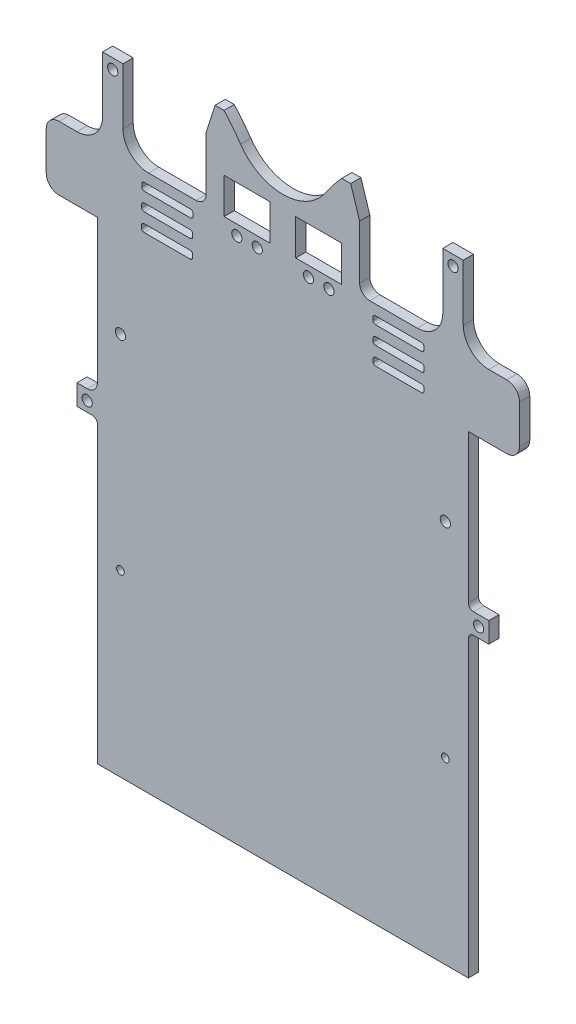
from build123d import *

# Parameters (mm, degrees)
SKETCH_1_R          = 2
SKETCH_1_R_2        = 1.5
EXTRUDE_1_DEPTH     = 4
SKETCH_2_R          = 2
CUT_EXTRUDE_1_DEPTH = 26
EXTRUDE_3_DEPTH     = 4
FILLET_1_R          = 4
FILLET_2_R          = 4
SKETCH_5_W          = 10
SKETCH_5_H          = 14
EXTRUDE_4_DEPTH     = 4
FILLET_3_R          = 4
FILLET_1_2_DEPTH    = 4
CUT_EXTRUDE_2_DEPTH = 10
FILLET_5_R          = 5


with BuildPart() as part:
    # 草图1 → 凸台-拉伸1 (new body)
    with BuildSketch(Plane.XY):
        with BuildLine():
            Line((0, -30), (0, 87))
            Line((0, 87), (-8, 87))
            Line((-8, 87), (-8, 95))
            Line((-8, 95), (0, 95))
            Line((0, 95), (0, 155))
            Line((0, 155), (-20, 155))
            Line((-20, 155), (-20, 180))
            Line((-20, 180), (-8, 180))
            ThreePointArc((-8, 180), (-0.928932188, 182.928932188), (2, 190))
            Line((2, 190), (2, 212))
            Line((2, 212), (10, 212))
            Line((10, 212), (10, 190))
            ThreePointArc((10, 190), (12.928932188, 182.928932188), (20, 180))
            Line((20, 180), (72.5, 180))
            Line((72.5, 180), (125, 180))
            ThreePointArc((125, 180), (132.071067812, 182.928932188), (135, 190))
            Line((135, 190), (135, 212))
            Line((135, 212), (143, 212))
            Line((143, 212), (143, 190))
            ThreePointArc((143, 190), (145.928932188, 182.928932188), (153, 180))
            Line((153, 180), (165, 180))
            Line((165, 180), (165, 155))
            Line((165, 155), (145, 155))
            Line((145, 155), (145, 95))
            Line((145, 95), (153, 95))
            Line((153, 95), (153, 87))
            Line((153, 87), (145, 87))
            Line((145, 87), (145, -30))
            Line((145, -30), (0, -30))
        make_face()
        with Locations(Location((9, 120, 0), (0, 0, 180))):
            Circle(SKETCH_1_R, mode=Mode.SUBTRACT)
        with Locations(Location((9, 40, 0), (0, 0, 180))):
            Circle(SKETCH_1_R_2, mode=Mode.SUBTRACT)
        with Locations((139, 208)):
            Circle(SKETCH_1_R, mode=Mode.SUBTRACT)
        with Locations(Location((149, 91, 0), (0, 0, 180))):
            Circle(SKETCH_1_R, mode=Mode.SUBTRACT)
        with Locations((136, 40)):
            Circle(SKETCH_1_R_2, mode=Mode.SUBTRACT)
        with Locations((136, 120)):
            Circle(SKETCH_1_R, mode=Mode.SUBTRACT)
        with Locations((-4, 91)):
            Circle(SKETCH_1_R, mode=Mode.SUBTRACT)
        with Locations(Location((6, 208, 0), (0, 0, 180))):
            Circle(SKETCH_1_R, mode=Mode.SUBTRACT)
    extrude(amount=EXTRUDE_1_DEPTH)

    # 草图2 → 切除-拉伸1 (cut)
    with BuildSketch(Plane(origin=(0, 0, 0), x_dir=(-1, 0, 0), z_dir=(0, 0, -1))):
        with Locations((-90.5, 176)):
            Circle(SKETCH_2_R)
        with Locations((-82.5, 176)):
            Circle(SKETCH_2_R)
        with Locations((-62.5, 176)):
            Circle(SKETCH_2_R)
        with Locations((-54.5, 176)):
            Circle(SKETCH_2_R)
    extrude(amount=-CUT_EXTRUDE_1_DEPTH, mode=Mode.SUBTRACT)

    # 草图4 → 凸台-拉伸3 (add)
    with BuildSketch(Plane(origin=(0, 0, 0), x_dir=(-1, 0, 0), z_dir=(0, 0, -1))):
        with BuildLine():
            Line((-102.5, 194), (-102.5, 204.972470671))
            Line((-102.5, 204.972470671), (-99, 215.944941341))
            Line((-99, 215.944941341), (-95.5, 215.944941341))
            ThreePointArc((-95.5, 215.944941341), (-92.121980777, 211.957020041), (-89.03099134, 207.742721229))
            ThreePointArc((-89.03099134, 207.742721229), (-72.5, 199), (-55.96900866, 207.742721229))
            ThreePointArc((-55.96900866, 207.742721229), (-52.878019223, 211.957020041), (-49.5, 215.944941341))
            Line((-49.5, 215.944941341), (-46, 215.944941341))
            Line((-46, 215.944941341), (-42.5, 204.972470671))
            Line((-42.5, 204.972470671), (-42.5, 194))
            Line((-42.5, 194), (-42.5, 180))
            Line((-42.5, 180), (-49.5, 180))
            Line((-49.5, 180), (-49.5, 194))
            Line((-49.5, 194), (-95.5, 194))
            Line((-95.5, 194), (-95.5, 180))
            Line((-95.5, 180), (-102.5, 180))
            Line((-102.5, 180), (-102.5, 194))
        make_face()
    extrude(amount=-EXTRUDE_3_DEPTH)

    # Fillet 1
    fillet_1_edges = [part.edges().sort_by_distance(p)[0] for p in [
        (102.5, 180, 2),
    ]]
    fillet(fillet_1_edges, radius=FILLET_1_R)

    # 圆角2
    fillet_2_edges = [part.edges().sort_by_distance(p)[0] for p in [
        (42.5, 180, 2),
    ]]
    fillet(fillet_2_edges, radius=FILLET_2_R)

    # 草图5 → 凸台-拉伸4 (add)
    with BuildSketch(Plane(origin=(0, 0, 0), x_dir=(-1, 0, 0), z_dir=(0, 0, -1))):
        with Locations((-72.5, 187)):
            Rectangle(SKETCH_5_W, SKETCH_5_H)
    extrude(amount=-EXTRUDE_4_DEPTH)

    # 圆角3
    fillet_3_edges = [part.edges().sort_by_distance(p)[0] for p in [
        (0, 95, 2),
    ]]
    fillet(fillet_3_edges, radius=FILLET_3_R)

    # Fillet 1 2: read off the stored shape, not the designer's step
    # Fillet 1 2 outline → Fillet 1 2 (add)
    with BuildSketch(Plane.XY):
        with BuildLine():
            add(Edge.make_bspline(
                [(0, 85), (0, 87), (-2, 87)],
                knots=[0, 0, 0, 1, 1, 1], degree=2, weights=[1, 0.707106781, 1]))
            Line((0, 85), (0, 87))
            Line((0, 87), (-2, 87))
        make_face()
        with BuildLine():
            add(Edge.make_bspline(
                [(145, 97), (145, 95), (147, 95)],
                knots=[0, 0, 0, 1, 1, 1], degree=2, weights=[1, 0.707106781, 1]))
            Line((145, 97), (145, 95))
            Line((145, 95), (147, 95))
        make_face()
        with BuildLine():
            add(Edge.make_bspline(
                [(147, 87), (145, 87), (145, 85)],
                knots=[0, 0, 0, 1, 1, 1], degree=2, weights=[1, 0.707106781, 1]))
            Line((147, 87), (145, 87))
            Line((145, 87), (145, 85))
        make_face()
    extrude(amount=FILLET_1_2_DEPTH)

    # 草图6 → 切除-拉伸2 (cut)
    with BuildSketch(Plane(origin=(0, 0, 0), x_dir=(-1, 0, 0), z_dir=(0, 0, -1))):
        with BuildLine():
            Line((-127.653125807, 175), (-127.653125807, 174))
            ThreePointArc((-127.653125807, 174), (-127.360232588, 173.292893219), (-126.653125807, 173))
            Line((-126.653125807, 173), (-108.653125807, 173))
            ThreePointArc((-108.653125807, 173), (-107.946019026, 173.292893219), (-107.653125807, 174))
            Line((-107.653125807, 174), (-107.653125807, 175))
            ThreePointArc((-107.653125807, 175), (-107.946019026, 175.707106781), (-108.653125807, 176))
            Line((-108.653125807, 176), (-126.653125807, 176))
            ThreePointArc((-126.653125807, 176), (-127.360232588, 175.707106781), (-127.653125807, 175))
        make_face()
        with BuildLine():
            Line((-36.251675409, 169), (-18.251675409, 169))
            ThreePointArc((-18.251675409, 169), (-17.544568628, 168.707106781), (-17.251675409, 168))
            Line((-17.251675409, 168), (-17.251675409, 167))
            ThreePointArc((-17.251675409, 167), (-17.544568628, 166.292893219), (-18.251675409, 166))
            Line((-18.251675409, 166), (-36.251675409, 166))
            ThreePointArc((-36.251675409, 166), (-36.958782191, 166.292893219), (-37.251675409, 167))
            Line((-37.251675409, 167), (-37.251675409, 168))
            ThreePointArc((-37.251675409, 168), (-36.958782191, 168.707106781), (-36.251675409, 169))
        make_face()
        with BuildLine():
            Line((-127.748324591, 168), (-127.748324591, 167))
            ThreePointArc((-127.748324591, 167), (-127.455431372, 166.292893219), (-126.748324591, 166))
            Line((-126.748324591, 166), (-108.748324591, 166))
            ThreePointArc((-108.748324591, 166), (-108.041217809, 166.292893219), (-107.748324591, 167))
            Line((-107.748324591, 167), (-107.748324591, 168))
            ThreePointArc((-107.748324591, 168), (-108.041217809, 168.707106781), (-108.748324591, 169))
            Line((-108.748324591, 169), (-126.748324591, 169))
            ThreePointArc((-126.748324591, 169), (-127.455431372, 168.707106781), (-127.748324591, 168))
        make_face()
        with BuildLine():
            Line((-36.346874193, 176), (-18.346874193, 176))
            ThreePointArc((-18.346874193, 176), (-17.639767412, 175.707106781), (-17.346874193, 175))
            Line((-17.346874193, 175), (-17.346874193, 174))
            ThreePointArc((-17.346874193, 174), (-17.639767412, 173.292893219), (-18.346874193, 173))
            Line((-18.346874193, 173), (-36.346874193, 173))
            ThreePointArc((-36.346874193, 173), (-37.053980974, 173.292893219), (-37.346874193, 174))
            Line((-37.346874193, 174), (-37.346874193, 175))
            ThreePointArc((-37.346874193, 175), (-37.053980974, 175.707106781), (-36.346874193, 176))
        make_face()
        with BuildLine():
            Line((-127.748324591, 161), (-127.748324591, 160))
            ThreePointArc((-127.748324591, 160), (-127.455431372, 159.292893219), (-126.748324591, 159))
            Line((-126.748324591, 159), (-108.748324591, 159))
            ThreePointArc((-108.748324591, 159), (-108.041217809, 159.292893219), (-107.748324591, 160))
            Line((-107.748324591, 160), (-107.748324591, 161))
            ThreePointArc((-107.748324591, 161), (-108.041217809, 161.707106781), (-108.748324591, 162))
            Line((-108.748324591, 162), (-126.748324591, 162))
            ThreePointArc((-126.748324591, 162), (-127.455431372, 161.707106781), (-127.748324591, 161))
        make_face()
        with BuildLine():
            Line((-37.251675409, 161), (-37.251675409, 160))
            ThreePointArc((-37.251675409, 160), (-36.958782191, 159.292893219), (-36.251675409, 159))
            Line((-36.251675409, 159), (-18.251675409, 159))
            ThreePointArc((-18.251675409, 159), (-17.544568628, 159.292893219), (-17.251675409, 160))
            Line((-17.251675409, 160), (-17.251675409, 161))
            ThreePointArc((-17.251675409, 161), (-17.544568628, 161.707106781), (-18.251675409, 162))
            Line((-18.251675409, 162), (-36.251675409, 162))
            ThreePointArc((-36.251675409, 162), (-36.958782191, 161.707106781), (-37.251675409, 161))
        make_face()
    extrude(amount=-CUT_EXTRUDE_2_DEPTH, mode=Mode.SUBTRACT)

    # 圆角5
    fillet_5_edges = [part.edges().sort_by_distance(p)[0] for p in [
        (165, 180, 2),
        (165, 155, 2),
        (-20, 155, 2),
        (-20, 180, 2),
    ]]
    fillet(fillet_5_edges, radius=FILLET_5_R)


solid = part.part
